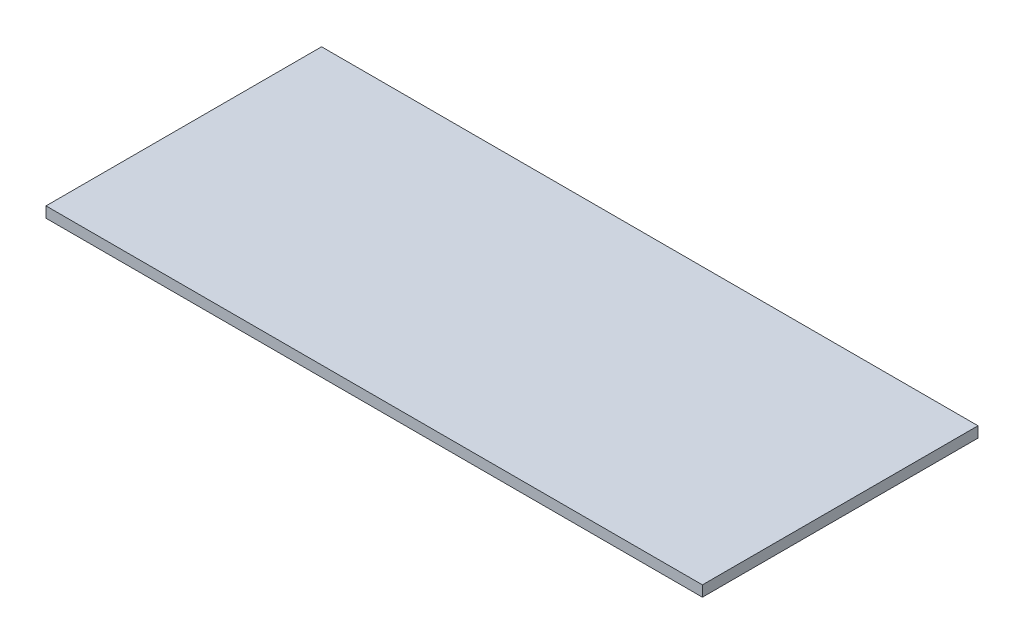
from build123d import *

# Parameters (mm, degrees)
SKETCH1_W           = 155.40277409
SKETCH1_H           = 65.241476427
BOSS_EXTRUDE1_DEPTH = 2.54


with BuildPart() as part:
    # Sketch1 → Boss-Extrude1 (new body)
    with BuildSketch(Plane(origin=(0, 0, 0), x_dir=(1, 0, 0), z_dir=(0, 1, 0))):
        with Locations((77.701387045, 32.620738214)):
            Rectangle(SKETCH1_W, SKETCH1_H)
    extrude(amount=BOSS_EXTRUDE1_DEPTH)


solid = part.part
